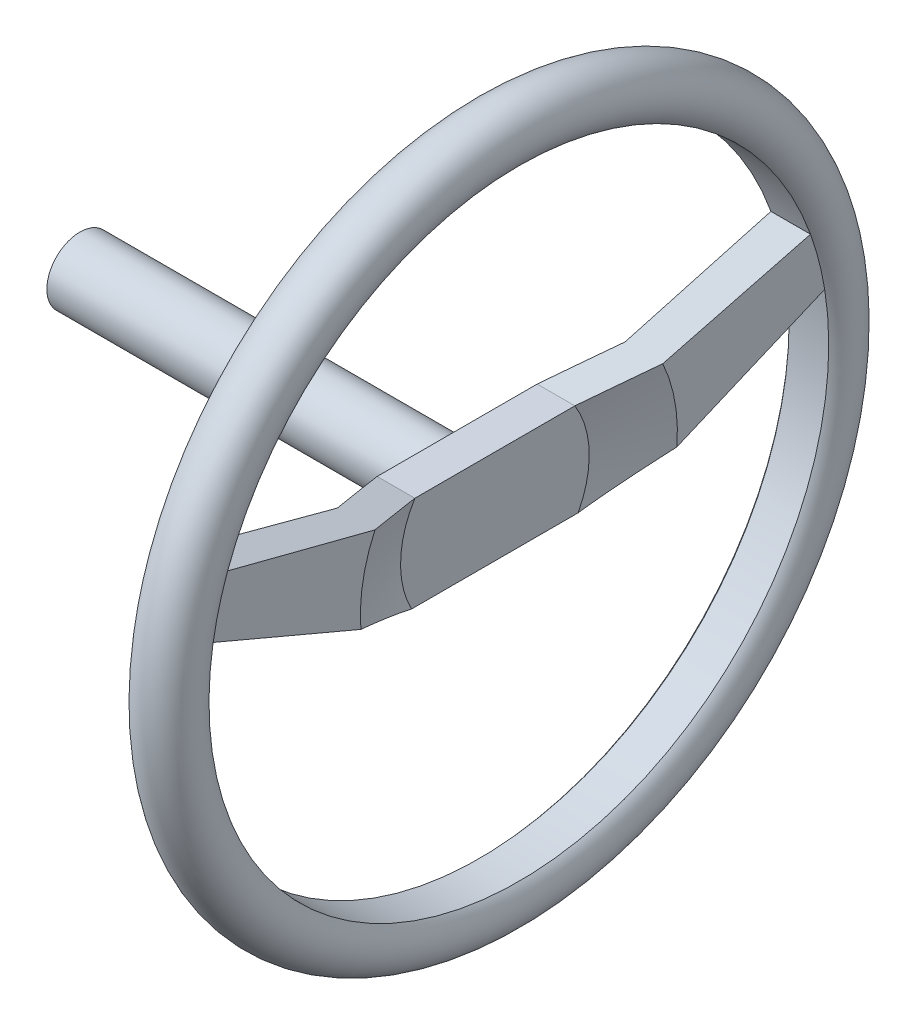
from build123d import *

# Parameters (mm, degrees)
CUT_EXTRUDE4_DEPTH  = 10
SKETCH8_R           = 1.75
BOSS_EXTRUDE2_DEPTH = 20


with BuildPart() as part:
    # Sketch1 → Revolve1 (revolve)
    with BuildSketch(Plane.XY):
        with BuildLine():
            Line((1.049704153, 16.428495828), (1.049704153, 8.403739981))
            Line((1.049704153, 8.403739981), (-0.222499961, 5))
            Line((-0.222499961, 5), (-0.222499961, 0))
            Line((-0.222499961, 0), (-1, 0))
            Line((-1, 0), (-2.222499961, 0))
            Line((-2.222499961, 0), (-2.222499961, 5))
            Line((-2.222499961, 5), (-0.950295847, 8.403739981))
            Line((-0.950295847, 8.403739981), (-1.049704153, 16.428495828))
            ThreePointArc((-1.049704153, 16.428495828), (0, 19), (1.049704153, 16.428495828))
        make_face()
    revolve(axis=Axis((-16.549613466, 0, 0), (1, 0, 0)))

    # Sketch7 → Cut-Extrude4 (cut)
    with BuildSketch(Plane(origin=(1.049704153, 0, 0), x_dir=(0, 0, -1), z_dir=(1, 0, 0))):
        with BuildLine():
            Line((-15.461138501, 5.554158028), (-4.23999152, 2.6499947))
            Line((-4.23999152, 2.6499947), (4.23999152, 2.6499947))
            Line((4.23999152, 2.6499947), (15.461138501, 5.554158028))
            ThreePointArc((15.461138501, 5.554158028), (0, 16.428495828), (-15.461138501, 5.554158028))
        make_face()
        with BuildLine():
            Line((-16.21335879, 2.6499947), (-4.413329252, -2.3500053))
            Line((-4.413329252, -2.3500053), (4.413329252, -2.3500053))
            Line((4.413329252, -2.3500053), (16.21335879, 2.6499947))
            ThreePointArc((16.21335879, 2.6499947), (0, -16.428495828), (-16.21335879, 2.6499947))
        make_face()
    extrude(amount=-CUT_EXTRUDE4_DEPTH, mode=Mode.SUBTRACT)

    # Sketch8 → Boss-Extrude2 (add)
    with BuildSketch(Plane.ZY.offset(2.222499961)):
        Circle(SKETCH8_R)
    extrude(amount=BOSS_EXTRUDE2_DEPTH)


solid = part.part
